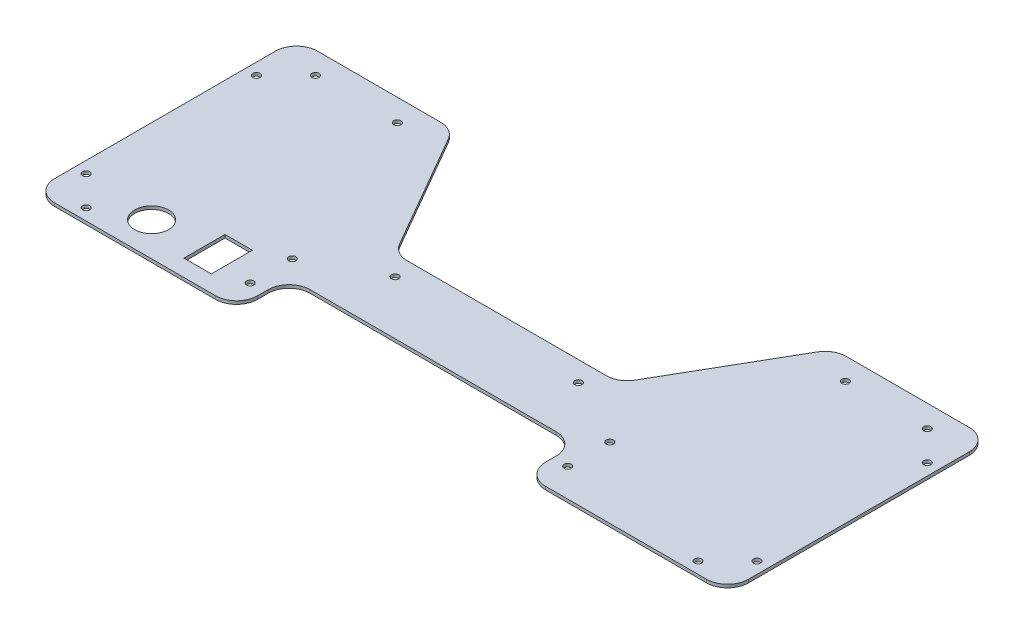
from build123d import *

# Parameters (mm, degrees)
BOSS_EXTRU_1_DEPTH      = 1.5
CONG_2_R                = 10
D_GAGEMENT_M31_D        = 3.4
ESQUISSE4_R             = 8.1
ESQUISSE4_W             = 13
ESQUISSE4_H             = 19.5
ENL_V_MAT_EXTRU_1_DEPTH = 191.400236344


with BuildPart() as part:
    # Esquisse1 → Boss.-Extru.1 (new body)
    with BuildSketch(Plane(origin=(0, 0, 0), x_dir=(1, 0, 0), z_dir=(0, 1, 0))):
        Polygon((-165, -30), (-68.5, -30), (-68.5, -5), (68.5, -5), (68.5, -30), (165, -30), (165, 90), (165, 95), (90.641016151, 95), (53.113248654, 30), (-53.113248654, 30), (-90.641016151, 95), (-165, 95), (-165, 90), align=None)
    extrude(amount=BOSS_EXTRU_1_DEPTH)

    # Congé2
    cong_2_edges = [part.edges().sort_by_distance(p)[0] for p in [
        (-165, 0.75, 30),
        (68.5, 0.75, 30),
        (68.5, 0.75, 5),
        (-68.5, 0.75, 5),
        (-68.5, 0.75, 30),
        (165, 0.75, 30),
        (90.641016151, 0.75, -95),
        (165, 0.75, -95),
        (53.113248654, 0.75, -30),
        (-53.113248654, 0.75, -30),
        (-90.641016151, 0.75, -95),
        (-165, 0.75, -95),
    ]]
    fillet(cong_2_edges, radius=CONG_2_R)

    # Dégagement M31 (through all)
    with Locations(Plane(origin=(0, 1.5, 0), x_dir=(1, 0, 0), z_dir=(0, 1, 0))):
        with Locations((-75.5, -16.5), (-75.5, 3.5), (75.5, -16.5), (75.5, 3.5), (-145.5, -24.5), (-159.5, -10.5), (-159.5, 70.5), (-145.5, 84.5), (145.5, -24.5), (159.5, -10.5), (145.5, 84.5), (159.5, 70.5), (-43.58, 20.5), (43.58, 20.5), (-106.53, 84.5), (106.53, 84.5)):
            Hole(D_GAGEMENT_M31_D / 2)

    # Esquisse4 → Enlèv. mat.-Extru.1 (cut, through all)
    with BuildSketch(Plane(origin=(0, 1.5, 0), x_dir=(1, 0, 0), z_dir=(0, 1, 0))):
        with Locations((-125, -13.9)):
            Circle(ESQUISSE4_R)
        with Locations((-95, -12.25)):
            Rectangle(ESQUISSE4_W, ESQUISSE4_H)
    extrude(amount=-ENL_V_MAT_EXTRU_1_DEPTH, mode=Mode.SUBTRACT)


solid = part.part
